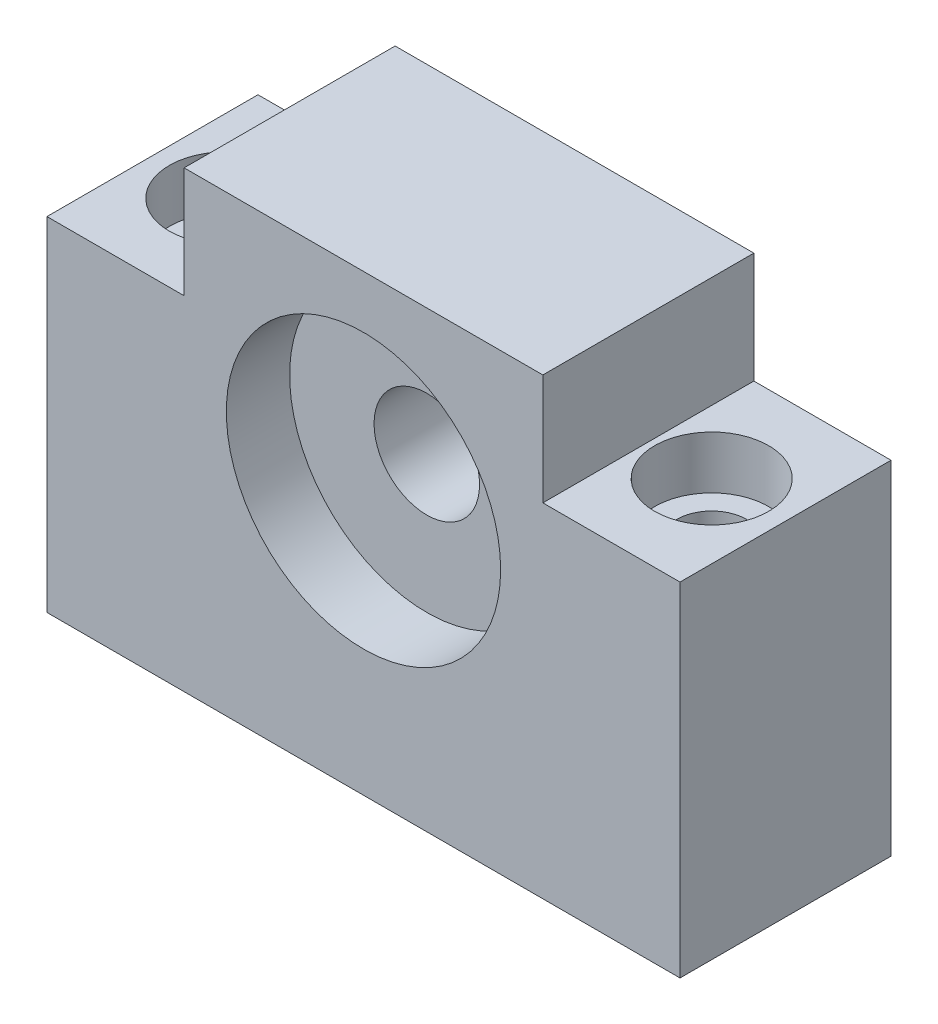
from build123d import *

# Parameters (mm, degrees)
ESQUISSE1_R             = 5
BOSS_EXTRU_1_DEPTH      = 20
ENL_V_MAT_EXTRU_1_REACH = 51.891
ESQUISSE2_R             = 3.3
ESQUISSE3_R             = 5.4
ENL_V_MAT_EXTRU_2_DEPTH = 5
ESQUISSE4_R             = 13
ENL_V_MAT_EXTRU_3_DEPTH = 6
ENL_V_START             = -6
ESQUISSE5_R             = 13
ENL_V_MAT_EXTRU_4_DEPTH = 6


with BuildPart() as part:
    # Esquisse1 → Boss.-Extru.1 (new body)
    with BuildSketch(Plane.XY):
        Polygon((-27.861974124, -13.935926773), (32.138025876, -13.935926773), (32.138025876, 18.564073227), (19.138025876, 18.564073227), (19.138025876, 29.064073227), (-14.861974124, 29.064073227), (-14.861974124, 18.564073227), (-27.861974124, 18.564073227), align=None)
        with Locations((2.138025876, 11.064073227)):
            Circle(ESQUISSE1_R, mode=Mode.SUBTRACT)
    extrude(amount=BOSS_EXTRU_1_DEPTH)

    # Esquisse2 → Enlèv. mat.-Extru.1 (cut, up to next)
    with BuildSketch(Plane(origin=(0, 18.564073227, 0), x_dir=(1, 0, 0), z_dir=(0, 1, 0)), mode=Mode.PRIVATE) as enl_v_mat_extru_1_sk1:
        with Locations((25.138025876, -10)):
            Circle(ESQUISSE2_R)
    enl_v_mat_extru_1_tool1 = extrude(enl_v_mat_extru_1_sk1.sketch, amount=-ENL_V_MAT_EXTRU_1_REACH, mode=Mode.PRIVATE) & part.part
    # Esquisse2 → Enlèv. mat.-Extru.1 (cut, up to next)
    with BuildSketch(Plane(origin=(0, 18.564073227, 0), x_dir=(1, 0, 0), z_dir=(0, 1, 0)), mode=Mode.PRIVATE) as enl_v_mat_extru_1_sk2:
        with Locations((-20.861974124, -10)):
            Circle(ESQUISSE2_R)
    enl_v_mat_extru_1_tool2 = extrude(enl_v_mat_extru_1_sk2.sketch, amount=-ENL_V_MAT_EXTRU_1_REACH, mode=Mode.PRIVATE) & part.part
    add(enl_v_mat_extru_1_tool1.solids().sort_by_distance((25.138026, 18.564073, 10))[0], mode=Mode.SUBTRACT)
    add(enl_v_mat_extru_1_tool2.solids().sort_by_distance((-20.861974, 18.564073, 10))[0], mode=Mode.SUBTRACT)

    # Esquisse3 → Enlèv. mat.-Extru.2 (cut)
    with BuildSketch(Plane(origin=(0, 18.564073227, 0), x_dir=(1, 0, 0), z_dir=(0, 1, 0))):
        with Locations((25.138025876, -10)):
            Circle(ESQUISSE3_R)
        with Locations((-20.861974124, -10)):
            Circle(ESQUISSE3_R)
    extrude(amount=-ENL_V_MAT_EXTRU_2_DEPTH, mode=Mode.SUBTRACT)

    # Esquisse4 → Enlèv. mat.-Extru.3 (cut)
    with BuildSketch(Plane.XY.offset(20)):
        with Locations((2.138025876, 11.064073227)):
            Circle(ESQUISSE4_R)
    extrude(amount=-ENL_V_MAT_EXTRU_3_DEPTH, mode=Mode.SUBTRACT)

    # Esquisse5 → Enlèv. mat.-Extru.4 (cut)
    with BuildSketch(Plane(origin=(0, 0, 0), x_dir=(-1, 0, 0), z_dir=(0, 0, -1)).offset(ENL_V_START)):
        with Locations((-2.138025876, 11.064073227)):
            Circle(ESQUISSE5_R)
    extrude(amount=ENL_V_MAT_EXTRU_4_DEPTH, mode=Mode.SUBTRACT)


solid = part.part
